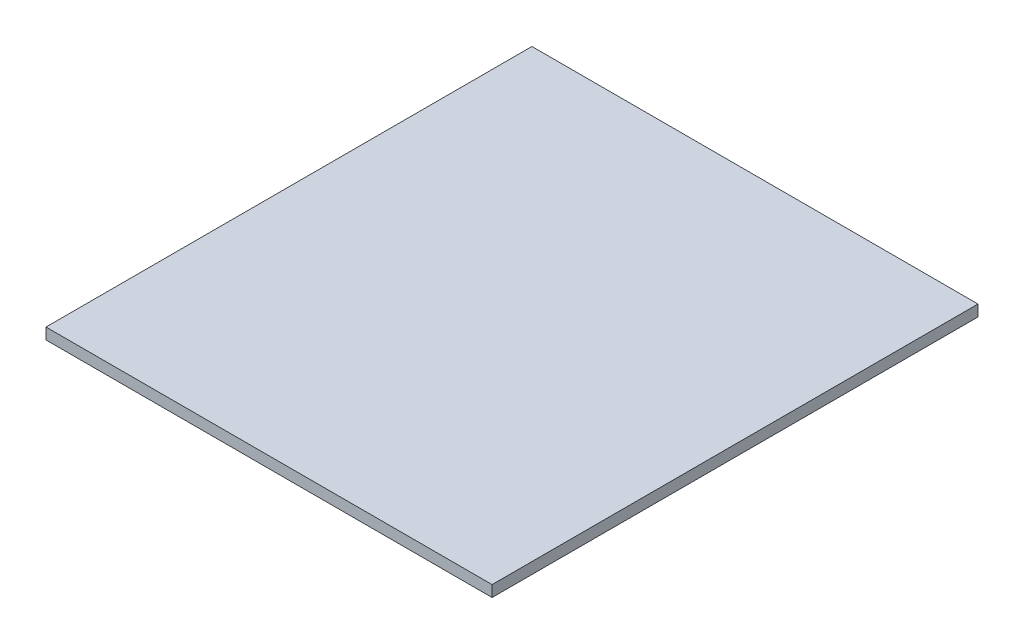
from build123d import *

# Parameters (mm, degrees)
SKETCH_1_W      = 79.5
SKETCH_1_H      = 86.6
EXTRUDE_1_DEPTH = 2


with BuildPart() as part:
    # Эскиз1 → Бобышка-Вытянуть1 (new body)
    with BuildSketch(Plane(origin=(0, 0, 0), x_dir=(1, 0, 0), z_dir=(0, 1, 0))):
        Rectangle(SKETCH_1_W, SKETCH_1_H)
    extrude(amount=EXTRUDE_1_DEPTH)


solid = part.part
